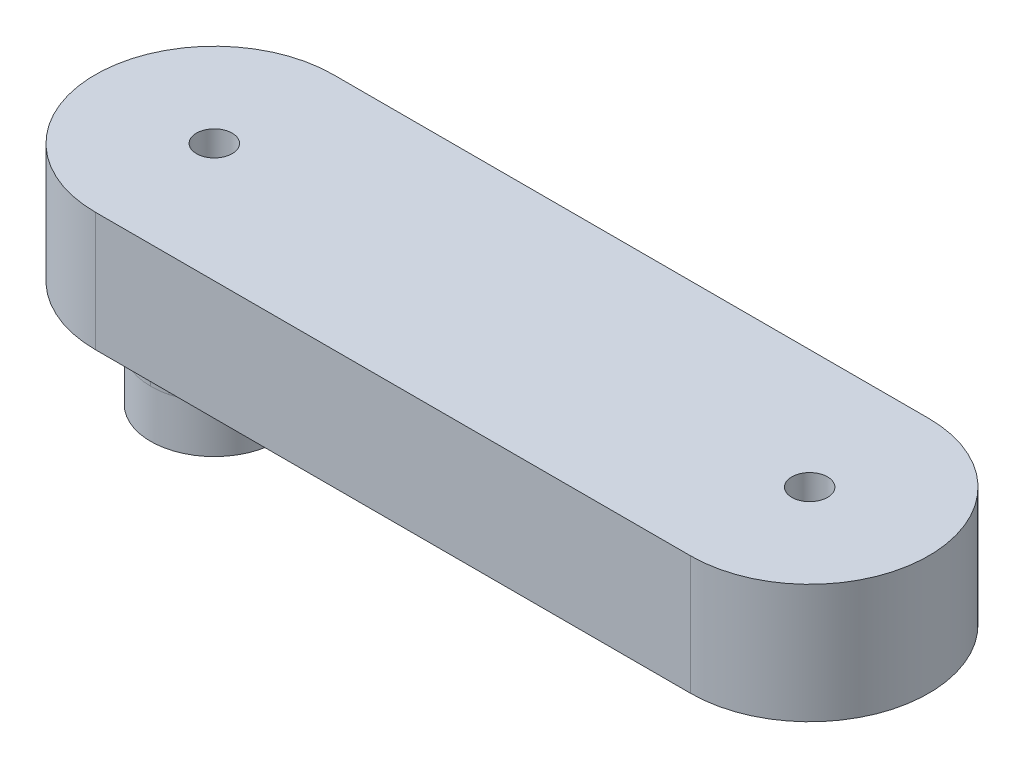
from build123d import *

# Parameters (mm, degrees)
BOSS_EXTRUDE1_DEPTH = 10
CUT_EXTRUDE1_REACH  = 39.749
SKETCH2_R           = 1.5
SKETCH5_R           = 5.35
BOSS_EXTRUDE3_DEPTH = 9
FILLET1_R           = 5
CUT_EXTRUDE2_REACH  = 43.061
SKETCH6_R           = 1.5


with BuildPart() as part:
    # Sketch1 → Boss-Extrude1 (new body)
    with BuildSketch(Plane(origin=(0, 0, 0), x_dir=(1, 0, 0), z_dir=(0, 1, 0))):
        with BuildLine():
            Line((-25, 10), (25, 10))
            ThreePointArc((25, 10), (35, 0), (25, -10))
            Line((25, -10), (-25, -10))
            ThreePointArc((-25, -10), (-35, 0), (-25, 10))
        make_face()
    extrude(amount=BOSS_EXTRUDE1_DEPTH)

    # Sketch2 → Cut-Extrude1 (cut, up to next)
    with BuildSketch(Plane(origin=(0, 10, 0), x_dir=(1, 0, 0), z_dir=(0, 1, 0)), mode=Mode.PRIVATE) as cut_extrude1_sk1:
        with Locations((25, 0)):
            Circle(SKETCH2_R)
    cut_extrude1_tool1 = extrude(cut_extrude1_sk1.sketch, amount=-CUT_EXTRUDE1_REACH, mode=Mode.PRIVATE) & part.part
    add(cut_extrude1_tool1.solids().sort_by_distance((25, 10, 0))[0], mode=Mode.SUBTRACT)

    # Sketch5 → Boss-Extrude3 (add)
    with BuildSketch(Plane.XZ):
        with Locations((-25, 0)):
            Circle(SKETCH5_R)
    extrude(amount=BOSS_EXTRUDE3_DEPTH)

    # Fillet1
    fillet1_edges = [part.edges().sort_by_distance(p)[0] for p in [
        (-30.35, 0, 0),
    ]]
    fillet(fillet1_edges, radius=FILLET1_R)

    # Sketch6 → Cut-Extrude2 (cut, up to next)
    with BuildSketch(Plane(origin=(0, -9, 0), x_dir=(-1, 0, 0), z_dir=(0, -1, 0)), mode=Mode.PRIVATE) as cut_extrude2_sk1:
        with Locations((25, 0)):
            Circle(SKETCH6_R)
    cut_extrude2_tool1 = extrude(cut_extrude2_sk1.sketch, amount=-CUT_EXTRUDE2_REACH, mode=Mode.PRIVATE) & part.part
    add(cut_extrude2_tool1.solids().sort_by_distance((-25, -9, 0))[0], mode=Mode.SUBTRACT)


solid = part.part
